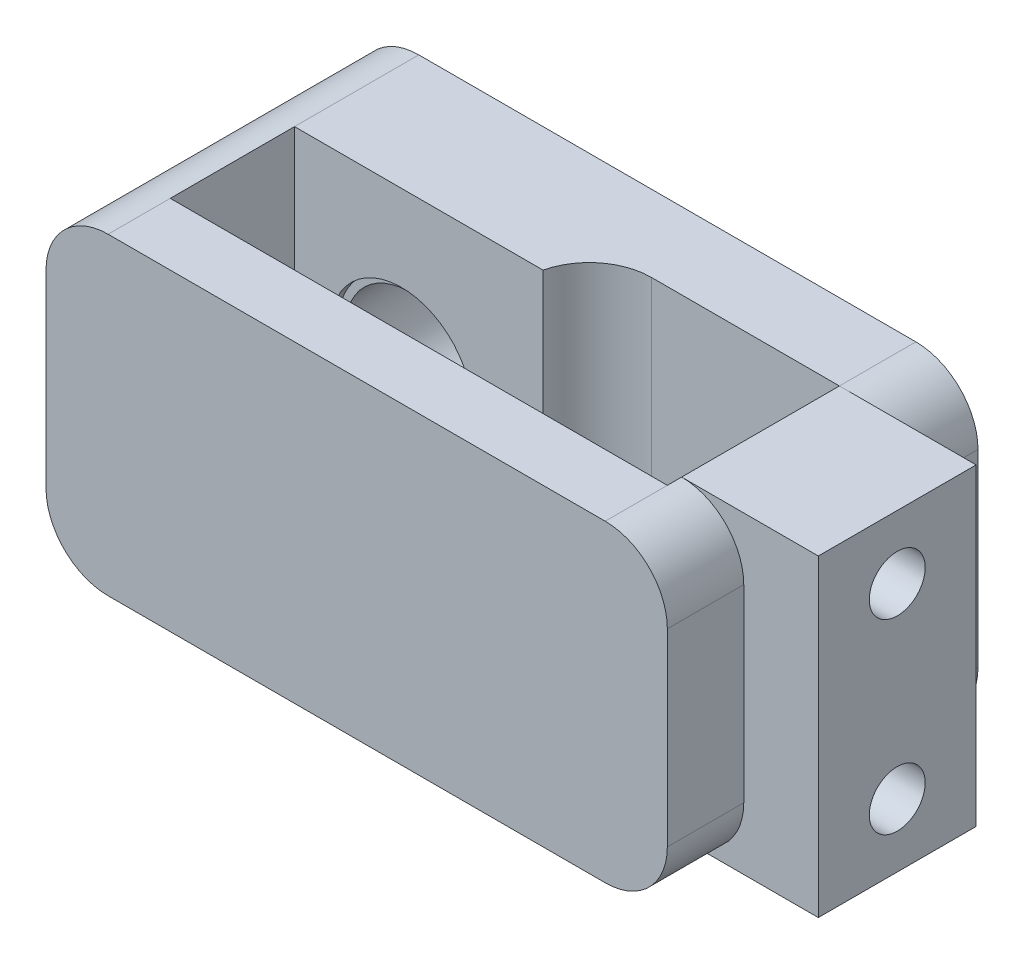
from build123d import *

# Parameters (mm, degrees)
SKETCH1_W                      = 50
SKETCH1_H                      = 25
SKETCH1_W_2                    = 40
SKETCH1_H_2                    = 10
BOSS_EXTRUDE1_DEPTH            = 25.2
HOLE1_D                        = 10.2
HOLE1_DEPTH                    = 10
HOLE1_CBORE_D                  = 11.4
HOLE1_CBORE_DEPTH              = 0.6
SKETCH10_W                     = 12.7
SKETCH10_H                     = 25.2
BOSS_EXTRUDE2_DEPTH            = 6
M4_CLEARANCE_HOLE1_D           = 4.5
M4_CLEARANCE_HOLE1_DEPTH       = 11
M4_CLEARANCE_HOLE1_CSINK_D     = 4.55
M4_CLEARANCE_HOLE1_CSINK_ANGLE = 90
SKETCH11_W                     = 20
SKETCH11_H                     = 3.85
CUT_EXTRUDE1_DEPTH             = 42.860363114
FILLET1_R                      = 5


with BuildPart() as part:
    # Sketch1 → Boss-Extrude1 (new body)
    with BuildSketch(Plane(origin=(0, 0, 0), x_dir=(1, 0, 0), z_dir=(0, 1, 0))):
        Rectangle(SKETCH1_W, SKETCH1_H)
        with Locations((0, -2.5)):
            Rectangle(SKETCH1_W_2, SKETCH1_H_2, mode=Mode.SUBTRACT)
    extrude(amount=BOSS_EXTRUDE1_DEPTH)

    # Hole1
    with Locations(Plane.XY.offset(-2.5)):
        with Locations((-11.4, 12.6)):
            CounterBoreHole(HOLE1_D / 2, HOLE1_CBORE_D / 2, HOLE1_CBORE_DEPTH, depth=HOLE1_DEPTH)

    # Sketch10 → Boss-Extrude2 (add)
    with BuildSketch(Plane(origin=(25, 0, 0), x_dir=(0, 0, -1), z_dir=(1, 0, 0))):
        with Locations((0, 12.6)):
            Rectangle(SKETCH10_W, SKETCH10_H)
    extrude(amount=BOSS_EXTRUDE2_DEPTH)

    # M4 Clearance Hole1
    with Locations(Plane.ZY.offset(-20)):
        with Locations((0, 20.1), (0, 5.1)):
            CounterSinkHole(M4_CLEARANCE_HOLE1_D / 2, M4_CLEARANCE_HOLE1_CSINK_D / 2, depth=M4_CLEARANCE_HOLE1_DEPTH, counter_sink_angle=M4_CLEARANCE_HOLE1_CSINK_ANGLE)

    # Sketch11 → Cut-Extrude1 (cut, through all)
    with BuildSketch(Plane(origin=(0, 25.2, 0), x_dir=(1, 0, 0), z_dir=(0, 1, 0))):
        with Locations((10, 4.425)):
            Rectangle(SKETCH11_W, SKETCH11_H)
    extrude(amount=-CUT_EXTRUDE1_DEPTH, mode=Mode.SUBTRACT)

    # Fillet1
    # the kernel refuses this fillet: 5 mm, written as the material it adds along each edge
    with BuildSketch(Plane(origin=(0, 25.2, -6.35), x_dir=(1, 0, 0), z_dir=(0, -1, 0))) as fillet1_piece_1:
        with BuildLine():
            CenterArc((4.865953144, 5), FILLET1_R, 193.297071747, 76.702928253)
            Line((0, 3.85), (0, 0))
            Line((0, 0), (4.865953144, 0))
        make_face()
    extrude(amount=25.2)
    # the kernel refuses this fillet: 5 mm, written as the material it takes off along each edge
    with BuildSketch(Plane(origin=(25, 0, -25), x_dir=(-1, 0, 0), z_dir=(0, 0, 1)), Plane(origin=(25, 0, 6.35), x_dir=(-1, 0, 0), z_dir=(0, 0, 1))) as fillet1_2_piece_1:
        with BuildLine():
            CenterArc((FILLET1_R, -FILLET1_R), FILLET1_R, 90, 90)
            Line((0, -FILLET1_R), (0, 0))
            Line((0, 0), (FILLET1_R, 0))
        make_face()
    extrude(amount=18.65, mode=Mode.SUBTRACT)
    with BuildSketch(Plane(origin=(25, 25.2, -25), x_dir=(-1, 0, 0), z_dir=(0, 0, 1)), Plane(origin=(25, 25.2, 6.35), x_dir=(-1, 0, 0), z_dir=(0, 0, 1))) as fillet1_2_piece_2:
        with BuildLine():
            CenterArc((FILLET1_R, FILLET1_R), FILLET1_R, 180, 90)
            Line((0, FILLET1_R), (0, 0))
            Line((0, 0), (FILLET1_R, 0))
        make_face()
    extrude(amount=18.65, mode=Mode.SUBTRACT)
    with BuildSketch(Plane(origin=(-25, 0, 25), x_dir=(0, 1, 0), z_dir=(0, 0, -1))) as fillet1_2_piece_3:
        with BuildLine():
            CenterArc((FILLET1_R, FILLET1_R), FILLET1_R, 180, 90)
            Line((0, FILLET1_R), (0, 0))
            Line((0, 0), (FILLET1_R, 0))
        make_face()
    extrude(amount=50, mode=Mode.SUBTRACT)
    with BuildSketch(Plane(origin=(-25, 25.2, 25), x_dir=(0, -1, 0), z_dir=(0, 0, -1))) as fillet1_2_piece_4:
        with BuildLine():
            CenterArc((FILLET1_R, -FILLET1_R), FILLET1_R, 90, 90)
            Line((0, -FILLET1_R), (0, 0))
            Line((0, 0), (FILLET1_R, 0))
        make_face()
    extrude(amount=50, mode=Mode.SUBTRACT)


solid = part.part
